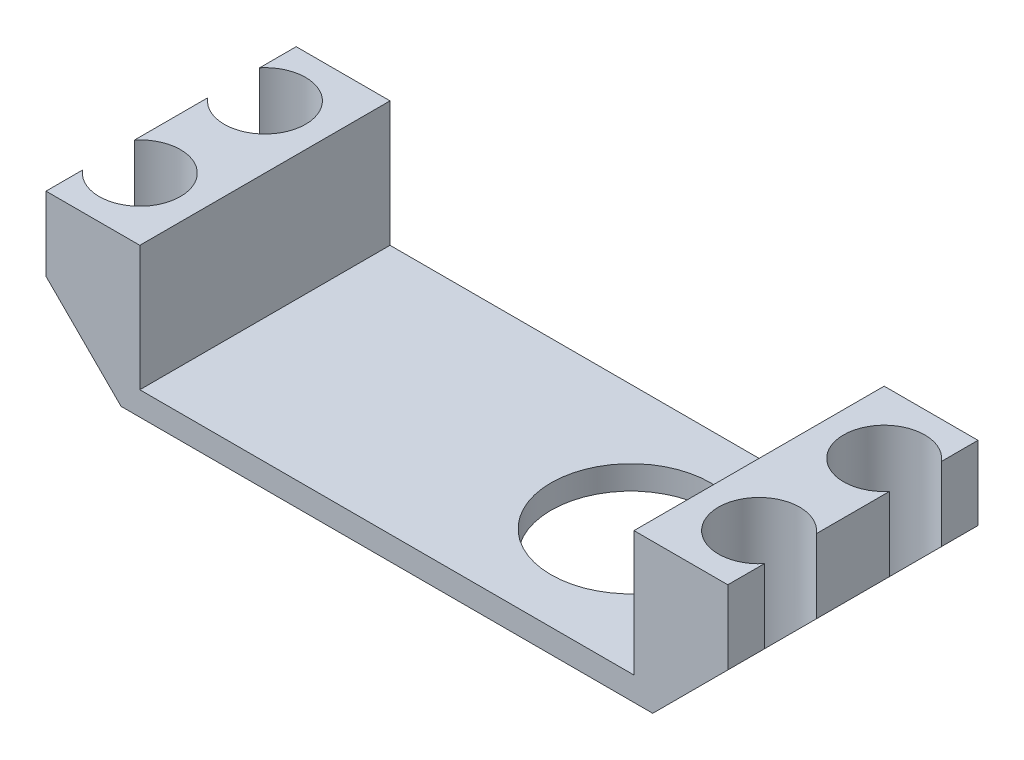
from build123d import *

# Parameters (mm, degrees)
BOSS_EXTRUDE1_DEPTH     = 20
CUT_EXTRUDE2_DEPTH      = 36.51580634
CUT_EXTRUDE2_DEPTH_BACK = 36.51580634
SKETCH2_R               = 3.25
CHAMFER1_SIZE           = 6
CUT_EXTRUDE3_DEPTH      = 36.51580634
CUT_EXTRUDE3_DEPTH_BACK = 36.51580634
SKETCH3_R               = 6.375


with BuildPart() as part:
    # Sketch1 → Boss-Extrude1 (new body)
    with BuildSketch(Plane.XY):
        Polygon((-27.25, 1), (-27.25, 10.9), (-19.75, 10.9), (-19.75, 0.9), (19.75, 0.9), (19.75, 10.9), (27.25, 10.9), (27.25, 1), (27.25, -1), (-27.25, -1), align=None)
    extrude(amount=BOSS_EXTRUDE1_DEPTH)

    # Sketch2 → Cut-Extrude2 (cut, two sides: drawn at the far end of the back side and taken through both)
    with BuildSketch(Plane(origin=(0, 0, 0), x_dir=(1, 0, 0), z_dir=(0, 1, 0)).offset(-CUT_EXTRUDE2_DEPTH_BACK)):
        with Locations((-24.75, -5)):
            Circle(SKETCH2_R)
        with Locations((24.75, -5)):
            Circle(SKETCH2_R)
        with Locations((24.75, -15)):
            Circle(SKETCH2_R)
        with Locations((-24.75, -15)):
            Circle(SKETCH2_R)
    extrude(amount=CUT_EXTRUDE2_DEPTH + CUT_EXTRUDE2_DEPTH_BACK, mode=Mode.SUBTRACT)

    # Chamfer1
    # the kernel refuses this chamfer: 6 mm, written as the material it takes off along each edge
    with BuildSketch(Plane(origin=(-27.25, -1, -15.430097928), x_dir=(-0.027495876610586206, 0.9996219169112968, 0), z_dir=(0, 0, 1))) as chamfer1_piece_1:
        Polygon((CHAMFER1_SIZE * 0.999621916911, -CHAMFER1_SIZE * 0.0274958766106), (-CHAMFER1_SIZE * 0.0274958766106, -CHAMFER1_SIZE * 0.999621916911), (0, 0), align=None)
    extrude(amount=33.78353989, mode=Mode.SUBTRACT)
    with BuildSketch(Plane(origin=(-27.25, -1, -8.353441962), x_dir=(-0.027495876610586206, 0.9996219169112968, 0), z_dir=(0, 0, 1))) as chamfer1_piece_2:
        Polygon((CHAMFER1_SIZE * 0.999621916911, -CHAMFER1_SIZE * 0.0274958766106), (-CHAMFER1_SIZE * 0.0274958766106, -CHAMFER1_SIZE * 0.999621916911), (0, 0), align=None)
    extrude(amount=36.706883924, mode=Mode.SUBTRACT)
    with BuildSketch(Plane(origin=(27.25, -1, -15.430097928), x_dir=(0.027495876610586202, 0.9996219169112968, 0), z_dir=(0, 0, 1)), Plane(origin=(27.25, -1, 1.646558038), x_dir=(0.027495876610586202, 0.9996219169112968, 0), z_dir=(0, 0, 1))) as chamfer1_piece_3:
        Polygon((CHAMFER1_SIZE * 0.999621916911, CHAMFER1_SIZE * 0.0274958766106), (-CHAMFER1_SIZE * 0.0274958766106, CHAMFER1_SIZE * 0.999621916911), (0, 0), align=None)
    extrude(amount=33.78353989, mode=Mode.SUBTRACT)
    with BuildSketch(Plane(origin=(27.25, -1, -8.353441962), x_dir=(0.027495876610586202, 0.9996219169112968, 0), z_dir=(0, 0, 1))) as chamfer1_piece_4:
        Polygon((CHAMFER1_SIZE * 0.999621916911, CHAMFER1_SIZE * 0.0274958766106), (-CHAMFER1_SIZE * 0.0274958766106, CHAMFER1_SIZE * 0.999621916911), (0, 0), align=None)
    extrude(amount=36.706883924, mode=Mode.SUBTRACT)

    # Sketch3 → Cut-Extrude3 (cut, two sides: drawn at the far end of the back side and taken through both)
    with BuildSketch(Plane(origin=(0, 0, 0), x_dir=(1, 0, 0), z_dir=(0, 1, 0)).offset(-CUT_EXTRUDE3_DEPTH_BACK)):
        with Locations(Location((9.5, -10, 0), (0, 0, 270))):
            Circle(SKETCH3_R)
    extrude(amount=CUT_EXTRUDE3_DEPTH + CUT_EXTRUDE3_DEPTH_BACK, mode=Mode.SUBTRACT)


solid = part.part
